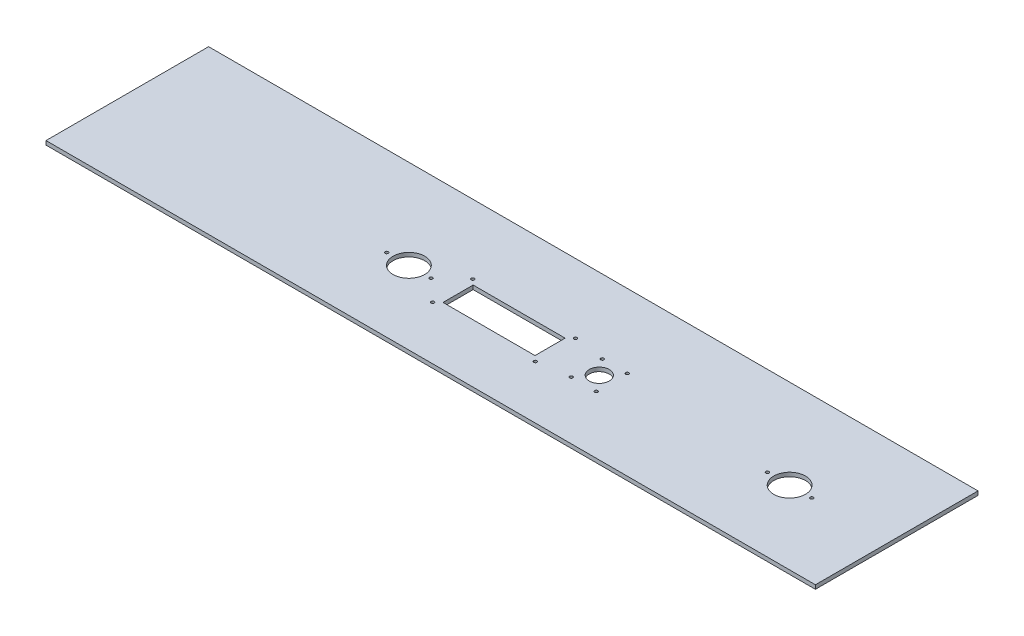
from build123d import *

# Parameters (mm, degrees)
SKETCH1_W           = 615.95
SKETCH1_H           = 130.175
BOSS_EXTRUDE1_DEPTH = 3.175
SKETCH2_R           = 1.25
SKETCH2_R_2         = 12.7
SKETCH2_R_3         = 8
SKETCH2_W           = 73.66
SKETCH2_H           = 24.13
CUT_EXTRUDE1_DEPTH  = 315.793684667


with BuildPart() as part:
    # Sketch1 → Boss-Extrude1 (new body)
    with BuildSketch(Plane(origin=(0, 0, 0), x_dir=(1, 0, 0), z_dir=(0, 1, 0))):
        Rectangle(SKETCH1_W, SKETCH1_H)
    extrude(amount=BOSS_EXTRUDE1_DEPTH)

    # Sketch2 → Cut-Extrude1 (cut, through all)
    with BuildSketch(Plane(origin=(0, 3.175, 0), x_dir=(1, 0, 0), z_dir=(0, 1, 0))):
        with Locations((41.099999842, 9.699999904)):
            Circle(SKETCH2_R)
        with Locations((41.099999842, -22.399999904)):
            Circle(SKETCH2_R)
        with Locations((-41.099999842, -22.399999904)):
            Circle(SKETCH2_R)
        with Locations((-41.099999842, 9.699999904)):
            Circle(SKETCH2_R)
        with Locations((-76.2, -6.35)):
            Circle(SKETCH2_R_2)
        with Locations((-93.98, -6.35)):
            Circle(SKETCH2_R)
        with Locations((-58.42, -6.35)):
            Circle(SKETCH2_R)
        with Locations((86.2, 6.15)):
            Circle(SKETCH2_R)
        with Locations((86.2, -18.85)):
            Circle(SKETCH2_R)
        with Locations((66.2, -18.85)):
            Circle(SKETCH2_R)
        with Locations((66.2, 6.15)):
            Circle(SKETCH2_R)
        with Locations((76.2, -6.35)):
            Circle(SKETCH2_R_3)
        with Locations((246.38, -6.35)):
            Circle(SKETCH2_R)
        with Locations((210.82, -6.35)):
            Circle(SKETCH2_R)
        with Locations((228.6, -6.35)):
            Circle(SKETCH2_R_2)
        with Locations((0, -6.35)):
            Rectangle(SKETCH2_W, SKETCH2_H)
    extrude(amount=-CUT_EXTRUDE1_DEPTH, mode=Mode.SUBTRACT)


solid = part.part
